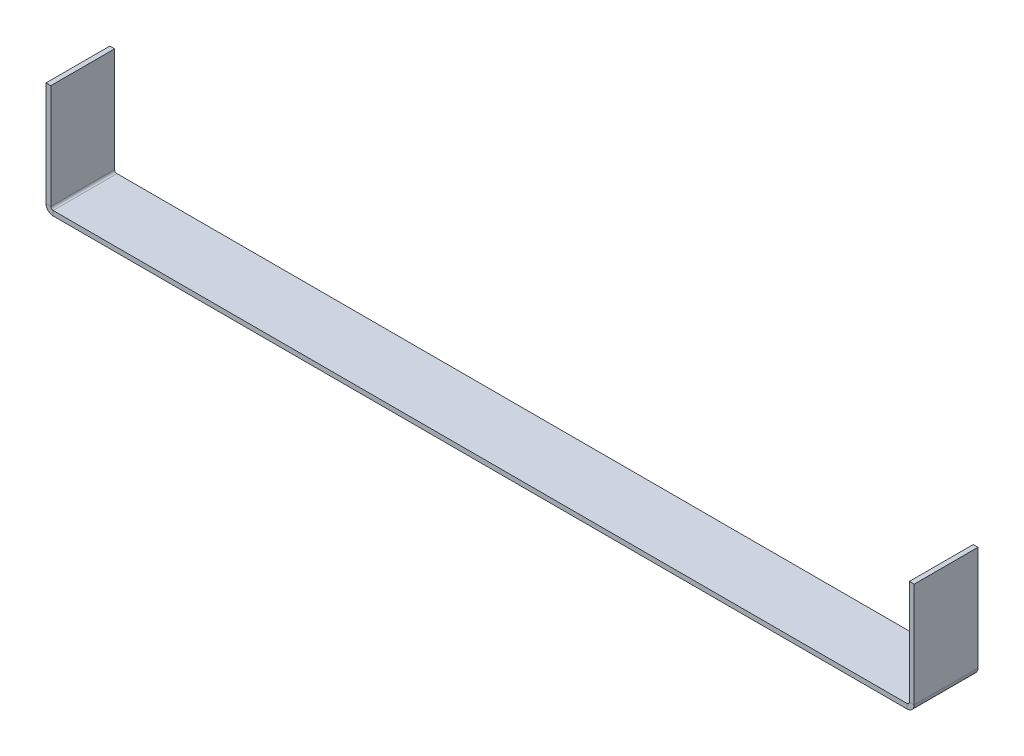
from build123d import *

# Parameters (mm, degrees)
SKETCH_1_W                       = 272
SKETCH_1_H                       = 20
SM_BASE_FLANGE_1_DEPTH           = 1.5
SM_EDGE_FLANGE_1_STRIP_W         = 7.4732
SM_EDGE_FLANGE_1_STRIP_H         = 1.5
SM_EDGE_FLANGE_1_STRIP_CUT_DEPTH = 20
SM_EDGE_FLANGE_1_DEPTH           = 20
SM_EDGE_FLANGE_2_STRIP_W         = 7.4732
SM_EDGE_FLANGE_2_STRIP_H         = 1.5
SM_EDGE_FLANGE_2_STRIP_CUT_DEPTH = 20
SM_EDGE_FLANGE_2_DEPTH           = 20


# Sheet-metal steps are written as plain solids
with BuildPart() as part:
    # Sketch 1 → Базовая кромка1 (new body)
    with BuildSketch(Plane(origin=(0, 0, 0), x_dir=(1, 0, 0), z_dir=(0, 1, 0))):
        with Locations((136, 10)):
            Rectangle(SKETCH_1_W, SKETCH_1_H)
    extrude(amount=-SM_BASE_FLANGE_1_DEPTH)

    # Ребро-кромка1 strip (across the edge) → Ребро-кромка1 strip cut (cut)
    with BuildSketch(Plane.XY.offset(-20)):
        with Locations((-1.5, -0.75)):
            Rectangle(SM_EDGE_FLANGE_1_STRIP_W, SM_EDGE_FLANGE_1_STRIP_H)
    extrude(amount=SM_EDGE_FLANGE_1_STRIP_CUT_DEPTH, mode=Mode.SUBTRACT)

    # Ребро-кромка1 section (across the edge) → Ребро-кромка1 (add)
    with BuildSketch(Plane.XY.offset(-20)):
        with BuildLine():
            Line((0, 0.7366), (0, 33.5))
            Line((0, 33.5), (1.5, 33.5))
            Line((1.5, 33.5), (1.5, 0.7366))
            ThreePointArc((1.5, 0.7366), (1.715745145, 0.215745145), (2.2366, 0))
            Line((2.2366, 0), (2.2366, -1.5))
            ThreePointArc((2.2366, -1.5), (0.655084973, -0.844915027), (0, 0.7366))
        make_face()
    extrude(amount=SM_EDGE_FLANGE_1_DEPTH)

    # Ребро-кромка2 strip (across the edge) → Ребро-кромка2 strip cut (cut)
    with BuildSketch(Plane(origin=(272, 0, 0), x_dir=(-1, 0, 0), z_dir=(0, 0, -1))):
        with Locations((-1.5, -0.75)):
            Rectangle(SM_EDGE_FLANGE_2_STRIP_W, SM_EDGE_FLANGE_2_STRIP_H)
    extrude(amount=SM_EDGE_FLANGE_2_STRIP_CUT_DEPTH, mode=Mode.SUBTRACT)

    # Ребро-кромка2 section (across the edge) → Ребро-кромка2 (add)
    with BuildSketch(Plane(origin=(272, 0, 0), x_dir=(-1, 0, 0), z_dir=(0, 0, -1))):
        with BuildLine():
            Line((0, 0.7366), (0, 33.5))
            Line((0, 33.5), (1.5, 33.5))
            Line((1.5, 33.5), (1.5, 0.7366))
            ThreePointArc((1.5, 0.7366), (1.715745145, 0.215745145), (2.2366, 0))
            Line((2.2366, 0), (2.2366, -1.5))
            ThreePointArc((2.2366, -1.5), (0.655084973, -0.844915027), (0, 0.7366))
        make_face()
    extrude(amount=SM_EDGE_FLANGE_2_DEPTH)


solid = part.part
